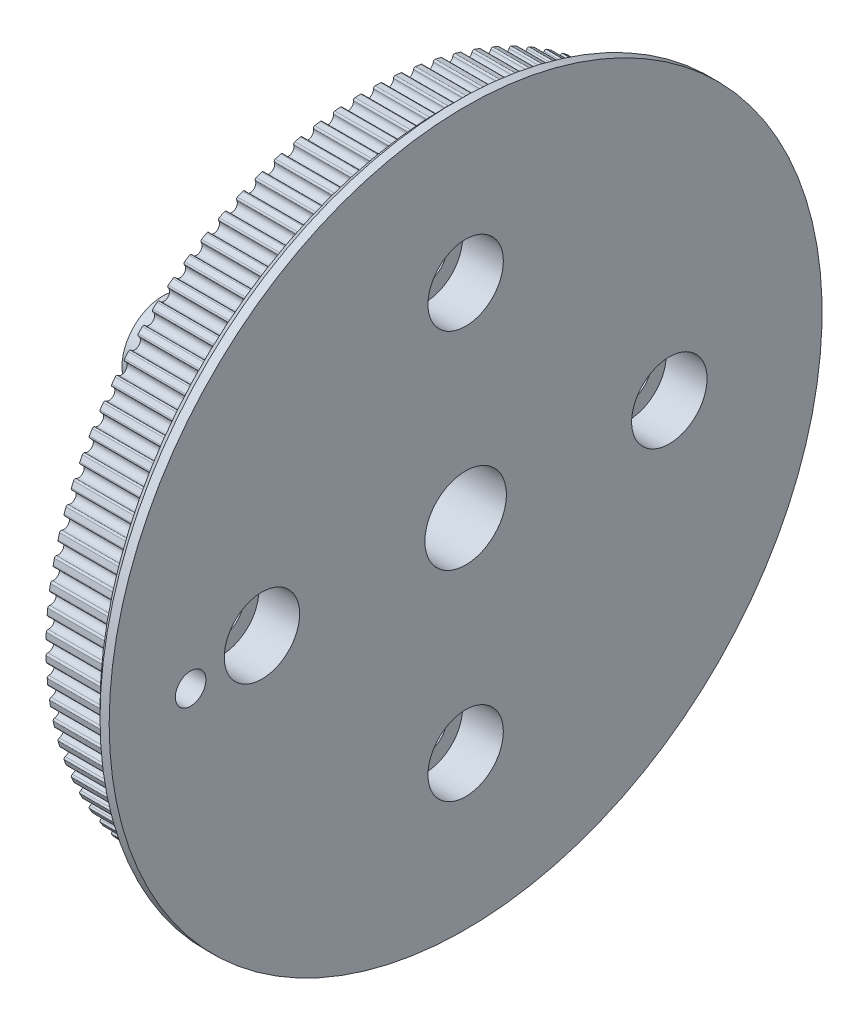
from build123d import *

# Parameters (mm, degrees)
SKETCH1_R           = 31.6
SKETCH1_R_2         = 4
BOSS_EXTRUDE1_DEPTH = 7.7
SKETCH2_R           = 0.55
CUT_EXTRUDE1_DEPTH  = 7.7
FILLET1_R           = 0.16
SKETCH3_R           = 35
SKETCH3_R_2         = 4
BOSS_EXTRUDE2_DEPTH = 1.9
SKETCH6_R           = 2.2
CUT_EXTRUDE6_DEPTH  = 9.6
SKETCH7_R           = 3.7
CUT_EXTRUDE4_DEPTH  = 4
CHAMFER1_SIZE       = 1
SKETCH5_R           = 4
BOSS_EXTRUDE3_DEPTH = 6
SKETCH8_R           = 1.5
CUT_EXTRUDE7_DEPTH  = 9.6


with BuildPart() as part:
    # Sketch1 → Boss-Extrude1 (new body)
    with BuildSketch(Plane(origin=(0, 0, 0), x_dir=(0, 0, -1), z_dir=(1, 0, 0))):
        with Locations(Location((0, 0, 0), (0, 0, 180))):
            Circle(SKETCH1_R)
        with Locations(Location((0, 0, 0), (0, 0, 180))):
            Circle(SKETCH1_R_2, mode=Mode.SUBTRACT)
    extrude(amount=BOSS_EXTRUDE1_DEPTH)

    # Sketch2 → Cut-Extrude1 (cut)
    with BuildSketch(Plane(origin=(0, 0, 0), x_dir=(0, 0, -1), z_dir=(1, 0, 0))):
        with Locations((0, 31.39)):
            Circle(SKETCH2_R)
        with Locations((1.970994408, 31.328059005)):
            Circle(SKETCH2_R)
        with Locations((3.934210202, 31.142480474)):
            Circle(SKETCH2_R)
        with Locations((5.881899465, 30.8339968)):
            Circle(SKETCH2_R)
        with Locations((7.806375558, 30.403825428)):
            Circle(SKETCH2_R)
        with Locations((9.700043453, 29.853664047)):
            Circle(SKETCH2_R)
        with Locations((11.555429709, 29.185683892)):
            Circle(SKETCH2_R)
        with Locations((13.365211962, 28.402521177)):
            Circle(SKETCH2_R)
        with Locations((15.12224783, 27.507266687)):
            Circle(SKETCH2_R)
        with Locations((16.819603094, 26.503453582)):
            Circle(SKETCH2_R)
        with Locations((18.450579069, 25.395043453)):
            Circle(SKETCH2_R)
        with Locations((20.008739038, 24.186410691)):
            Circle(SKETCH2_R)
        with Locations((21.487933655, 22.882325215)):
            Circle(SKETCH2_R)
        with Locations((22.882325215, 21.487933655)):
            Circle(SKETCH2_R)
        with Locations((24.186410691, 20.008739038)):
            Circle(SKETCH2_R)
        with Locations((25.395043453, 18.450579069)):
            Circle(SKETCH2_R)
        with Locations((26.503453582, 16.819603094)):
            Circle(SKETCH2_R)
        with Locations((27.507266687, 15.12224783)):
            Circle(SKETCH2_R)
        with Locations((28.402521177, 13.365211962)):
            Circle(SKETCH2_R)
        with Locations((29.185683892, 11.555429709)):
            Circle(SKETCH2_R)
        with Locations((29.853664047, 9.700043453)):
            Circle(SKETCH2_R)
        with Locations((30.403825428, 7.806375558)):
            Circle(SKETCH2_R)
        with Locations((30.8339968, 5.881899465)):
            Circle(SKETCH2_R)
        with Locations((31.142480474, 3.934210202)):
            Circle(SKETCH2_R)
        with Locations((31.328059005, 1.970994408)):
            Circle(SKETCH2_R)
        with Locations((31.39, 0)):
            Circle(SKETCH2_R)
        with Locations((31.328059005, -1.970994408)):
            Circle(SKETCH2_R)
        with Locations((31.142480474, -3.934210202)):
            Circle(SKETCH2_R)
        with Locations((30.8339968, -5.881899465)):
            Circle(SKETCH2_R)
        with Locations((30.403825428, -7.806375558)):
            Circle(SKETCH2_R)
        with Locations((29.853664047, -9.700043453)):
            Circle(SKETCH2_R)
        with Locations((29.185683892, -11.555429709)):
            Circle(SKETCH2_R)
        with Locations((28.402521177, -13.365211962)):
            Circle(SKETCH2_R)
        with Locations((27.507266687, -15.12224783)):
            Circle(SKETCH2_R)
        with Locations((26.503453582, -16.819603094)):
            Circle(SKETCH2_R)
        with Locations((25.395043453, -18.450579069)):
            Circle(SKETCH2_R)
        with Locations((24.186410691, -20.008739038)):
            Circle(SKETCH2_R)
        with Locations((22.882325215, -21.487933655)):
            Circle(SKETCH2_R)
        with Locations((21.487933655, -22.882325215)):
            Circle(SKETCH2_R)
        with Locations((20.008739038, -24.186410691)):
            Circle(SKETCH2_R)
        with Locations((18.450579069, -25.395043453)):
            Circle(SKETCH2_R)
        with Locations((16.819603094, -26.503453582)):
            Circle(SKETCH2_R)
        with Locations((15.12224783, -27.507266687)):
            Circle(SKETCH2_R)
        with Locations((13.365211962, -28.402521177)):
            Circle(SKETCH2_R)
        with Locations((11.555429709, -29.185683892)):
            Circle(SKETCH2_R)
        with Locations((9.700043453, -29.853664047)):
            Circle(SKETCH2_R)
        with Locations((7.806375558, -30.403825428)):
            Circle(SKETCH2_R)
        with Locations((5.881899465, -30.8339968)):
            Circle(SKETCH2_R)
        with Locations((3.934210202, -31.142480474)):
            Circle(SKETCH2_R)
        with Locations((1.970994408, -31.328059005)):
            Circle(SKETCH2_R)
        with Locations((0, -31.39)):
            Circle(SKETCH2_R)
        with Locations((-1.970994408, -31.328059005)):
            Circle(SKETCH2_R)
        with Locations((-3.934210202, -31.142480474)):
            Circle(SKETCH2_R)
        with Locations((-5.881899465, -30.8339968)):
            Circle(SKETCH2_R)
        with Locations((-7.806375558, -30.403825428)):
            Circle(SKETCH2_R)
        with Locations((-9.700043453, -29.853664047)):
            Circle(SKETCH2_R)
        with Locations((-11.555429709, -29.185683892)):
            Circle(SKETCH2_R)
        with Locations((-13.365211962, -28.402521177)):
            Circle(SKETCH2_R)
        with Locations((-15.12224783, -27.507266687)):
            Circle(SKETCH2_R)
        with Locations((-16.819603094, -26.503453582)):
            Circle(SKETCH2_R)
        with Locations((-18.450579069, -25.395043453)):
            Circle(SKETCH2_R)
        with Locations((-20.008739038, -24.186410691)):
            Circle(SKETCH2_R)
        with Locations((-21.487933655, -22.882325215)):
            Circle(SKETCH2_R)
        with Locations((-22.882325215, -21.487933655)):
            Circle(SKETCH2_R)
        with Locations((-24.186410691, -20.008739038)):
            Circle(SKETCH2_R)
        with Locations((-25.395043453, -18.450579069)):
            Circle(SKETCH2_R)
        with Locations((-26.503453582, -16.819603094)):
            Circle(SKETCH2_R)
        with Locations((-27.507266687, -15.12224783)):
            Circle(SKETCH2_R)
        with Locations((-28.402521177, -13.365211962)):
            Circle(SKETCH2_R)
        with Locations((-29.185683892, -11.555429709)):
            Circle(SKETCH2_R)
        with Locations((-29.853664047, -9.700043453)):
            Circle(SKETCH2_R)
        with Locations((-30.403825428, -7.806375558)):
            Circle(SKETCH2_R)
        with Locations((-30.8339968, -5.881899465)):
            Circle(SKETCH2_R)
        with Locations((-31.142480474, -3.934210202)):
            Circle(SKETCH2_R)
        with Locations((-31.328059005, -1.970994408)):
            Circle(SKETCH2_R)
        with Locations((-31.39, 0)):
            Circle(SKETCH2_R)
        with Locations((-31.328059005, 1.970994408)):
            Circle(SKETCH2_R)
        with Locations((-31.142480474, 3.934210202)):
            Circle(SKETCH2_R)
        with Locations((-30.8339968, 5.881899465)):
            Circle(SKETCH2_R)
        with Locations((-30.403825428, 7.806375558)):
            Circle(SKETCH2_R)
        with Locations((-29.853664047, 9.700043453)):
            Circle(SKETCH2_R)
        with Locations((-29.185683892, 11.555429709)):
            Circle(SKETCH2_R)
        with Locations((-28.402521177, 13.365211962)):
            Circle(SKETCH2_R)
        with Locations((-27.507266687, 15.12224783)):
            Circle(SKETCH2_R)
        with Locations((-26.503453582, 16.819603094)):
            Circle(SKETCH2_R)
        with Locations((-25.395043453, 18.450579069)):
            Circle(SKETCH2_R)
        with Locations((-24.186410691, 20.008739038)):
            Circle(SKETCH2_R)
        with Locations((-22.882325215, 21.487933655)):
            Circle(SKETCH2_R)
        with Locations((-21.487933655, 22.882325215)):
            Circle(SKETCH2_R)
        with Locations((-20.008739038, 24.186410691)):
            Circle(SKETCH2_R)
        with Locations((-18.450579069, 25.395043453)):
            Circle(SKETCH2_R)
        with Locations((-16.819603094, 26.503453582)):
            Circle(SKETCH2_R)
        with Locations((-15.12224783, 27.507266687)):
            Circle(SKETCH2_R)
        with Locations((-13.365211962, 28.402521177)):
            Circle(SKETCH2_R)
        with Locations((-11.555429709, 29.185683892)):
            Circle(SKETCH2_R)
        with Locations((-9.700043453, 29.853664047)):
            Circle(SKETCH2_R)
        with Locations((-7.806375558, 30.403825428)):
            Circle(SKETCH2_R)
        with Locations((-5.881899465, 30.8339968)):
            Circle(SKETCH2_R)
        with Locations((-3.934210202, 31.142480474)):
            Circle(SKETCH2_R)
        with Locations((-1.970994408, 31.328059005)):
            Circle(SKETCH2_R)
    extrude(amount=CUT_EXTRUDE1_DEPTH, mode=Mode.SUBTRACT)

    # Fillet1
    fillet1_edges = [part.edges().sort_by_distance(p)[0] for p in [
        (3.85, 31.59588404, 0.510011532),
        (3.85, 31.59588404, -0.510011532),
        (3.85, 31.501512891, 2.492927114),
        (3.85, 31.565560669, 1.474916834),
        (3.85, 31.282819662, 4.466004252),
        (3.85, 31.410662451, 3.454024376),
        (3.85, 30.940667436, 6.421456112),
        (3.85, 31.131800699, 5.419500462),
        (3.85, 30.476406531, 8.351565418),
        (3.85, 30.730075952, 7.363588255),
        (3.85, 29.891869173, 10.248714911),
        (3.85, 30.207073634, 9.27861533),
        (3.85, 29.189362264, 12.105417408),
        (3.85, 29.564857798, 11.157023949),
        (3.85, 28.371658277, 13.914345353),
        (3.85, 28.805962974, 12.991400892),
        (3.85, 27.441984317, 15.668359734),
        (3.85, 27.933384175, 14.774506711),
        (3.85, 26.404009381, 17.360538258),
        (3.85, 26.95056507, 16.499304301),
        (3.85, 25.261829884, 18.984202668),
        (3.85, 25.861384397, 18.158986675),
        (3.85, 24.019953484, 20.532945103),
        (3.85, 24.670140655, 19.747003825),
        (3.85, 22.683281303, 22.000653385),
        (3.85, 23.381535138, 21.257088572),
        (3.85, 21.257088572, 23.381535138),
        (3.85, 22.000653385, 22.683281303),
        (3.85, 19.747003825, 24.670140655),
        (3.85, 20.532945103, 24.019953484),
        (3.85, 18.158986675, 25.861384397),
        (3.85, 18.984202668, 25.261829884),
        (3.85, 16.499304301, 26.95056507),
        (3.85, 17.360538258, 26.404009381),
        (3.85, 14.774506711, 27.933384175),
        (3.85, 15.668359734, 27.441984317),
        (3.85, 12.991400892, 28.805962974),
        (3.85, 13.914345353, 28.371658277),
        (3.85, 11.157023949, 29.564857798),
        (3.85, 12.105417408, 29.189362264),
        (3.85, 9.27861533, 30.207073634),
        (3.85, 10.248714911, 29.891869173),
        (3.85, 7.363588255, 30.730075952),
        (3.85, 8.351565418, 30.476406531),
        (3.85, 5.419500462, 31.131800699),
        (3.85, 6.421456112, 30.940667436),
        (3.85, 3.454024376, 31.410662451),
        (3.85, 4.466004252, 31.282819662),
        (3.85, 1.474916834, 31.565560669),
        (3.85, 2.492927114, 31.501512891),
        (3.85, -0.510011532, 31.59588404),
        (3.85, 0.510011532, 31.59588404),
        (3.85, -2.492927114, 31.501512891),
        (3.85, -1.474916834, 31.565560669),
        (3.85, -4.466004252, 31.282819662),
        (3.85, -3.454024376, 31.410662451),
        (3.85, -6.421456112, 30.940667436),
        (3.85, -5.419500462, 31.131800699),
        (3.85, -8.351565418, 30.476406531),
        (3.85, -7.363588255, 30.730075952),
        (3.85, -10.248714911, 29.891869173),
        (3.85, -9.27861533, 30.207073634),
        (3.85, -12.105417408, 29.189362264),
        (3.85, -11.157023949, 29.564857798),
        (3.85, -13.914345353, 28.371658277),
        (3.85, -12.991400892, 28.805962974),
        (3.85, -15.668359734, 27.441984317),
        (3.85, -14.774506711, 27.933384175),
        (3.85, -17.360538258, 26.404009381),
        (3.85, -16.499304301, 26.95056507),
        (3.85, -18.984202668, 25.261829884),
        (3.85, -18.158986675, 25.861384397),
        (3.85, -20.532945103, 24.019953484),
        (3.85, -19.747003825, 24.670140655),
        (3.85, -22.000653385, 22.683281303),
        (3.85, -21.257088572, 23.381535138),
        (3.85, -23.381535138, 21.257088572),
        (3.85, -22.683281303, 22.000653385),
        (3.85, -24.670140655, 19.747003825),
        (3.85, -24.019953484, 20.532945103),
        (3.85, -25.861384397, 18.158986675),
        (3.85, -25.261829884, 18.984202668),
        (3.85, -26.95056507, 16.499304301),
        (3.85, -26.404009381, 17.360538258),
        (3.85, -27.933384175, 14.774506711),
        (3.85, -27.441984317, 15.668359734),
        (3.85, -28.805962974, 12.991400892),
        (3.85, -28.371658277, 13.914345353),
        (3.85, -29.564857798, 11.157023949),
        (3.85, -29.189362264, 12.105417408),
        (3.85, -30.207073634, 9.27861533),
        (3.85, -29.891869173, 10.248714911),
        (3.85, -30.730075952, 7.363588255),
        (3.85, -30.476406531, 8.351565418),
        (3.85, -31.131800699, 5.419500462),
        (3.85, -30.940667436, 6.421456112),
        (3.85, -31.410662451, 3.454024376),
        (3.85, -31.282819662, 4.466004252),
        (3.85, -31.565560669, 1.474916834),
        (3.85, -31.501512891, 2.492927114),
        (3.85, -31.59588404, -0.510011532),
        (3.85, -31.59588404, 0.510011532),
        (3.85, -31.501512891, -2.492927114),
        (3.85, -31.565560669, -1.474916834),
        (3.85, -31.282819662, -4.466004252),
        (3.85, -31.410662451, -3.454024376),
        (3.85, -30.940667436, -6.421456112),
        (3.85, -31.131800699, -5.419500462),
        (3.85, -30.476406531, -8.351565418),
        (3.85, -30.730075952, -7.363588255),
        (3.85, -29.891869173, -10.248714911),
        (3.85, -30.207073634, -9.27861533),
        (3.85, -29.189362264, -12.105417408),
        (3.85, -29.564857798, -11.157023949),
        (3.85, -28.371658277, -13.914345353),
        (3.85, -28.805962974, -12.991400892),
        (3.85, -27.441984317, -15.668359734),
        (3.85, -27.933384175, -14.774506711),
        (3.85, -26.404009381, -17.360538258),
        (3.85, -26.95056507, -16.499304301),
        (3.85, -25.261829884, -18.984202668),
        (3.85, -25.861384397, -18.158986675),
        (3.85, -24.019953484, -20.532945103),
        (3.85, -24.670140655, -19.747003825),
        (3.85, -22.683281303, -22.000653385),
        (3.85, -23.381535138, -21.257088572),
        (3.85, -21.257088572, -23.381535138),
        (3.85, -22.000653385, -22.683281303),
        (3.85, -19.747003825, -24.670140655),
        (3.85, -20.532945103, -24.019953484),
        (3.85, -18.158986675, -25.861384397),
        (3.85, -18.984202668, -25.261829884),
        (3.85, -16.499304301, -26.95056507),
        (3.85, -17.360538258, -26.404009381),
        (3.85, -14.774506711, -27.933384175),
        (3.85, -15.668359734, -27.441984317),
        (3.85, -12.991400892, -28.805962974),
        (3.85, -13.914345353, -28.371658277),
        (3.85, -11.157023949, -29.564857798),
        (3.85, -12.105417408, -29.189362264),
        (3.85, -9.27861533, -30.207073634),
        (3.85, -10.248714911, -29.891869173),
        (3.85, -7.363588255, -30.730075952),
        (3.85, -8.351565418, -30.476406531),
        (3.85, -5.419500462, -31.131800699),
        (3.85, -6.421456112, -30.940667436),
        (3.85, -3.454024376, -31.410662451),
        (3.85, -4.466004252, -31.282819662),
        (3.85, -1.474916834, -31.565560669),
        (3.85, -2.492927114, -31.501512891),
        (3.85, 0.510011532, -31.59588404),
        (3.85, -0.510011532, -31.59588404),
        (3.85, 2.492927114, -31.501512891),
        (3.85, 1.474916834, -31.565560669),
        (3.85, 4.466004252, -31.282819662),
        (3.85, 3.454024376, -31.410662451),
        (3.85, 6.421456112, -30.940667436),
        (3.85, 5.419500462, -31.131800699),
        (3.85, 8.351565418, -30.476406531),
        (3.85, 7.363588255, -30.730075952),
        (3.85, 10.248714911, -29.891869173),
        (3.85, 9.27861533, -30.207073634),
        (3.85, 12.105417408, -29.189362264),
        (3.85, 11.157023949, -29.564857798),
        (3.85, 13.914345353, -28.371658277),
        (3.85, 12.991400892, -28.805962974),
        (3.85, 15.668359734, -27.441984317),
        (3.85, 14.774506711, -27.933384175),
        (3.85, 17.360538258, -26.404009381),
        (3.85, 16.499304301, -26.95056507),
        (3.85, 18.984202668, -25.261829884),
        (3.85, 18.158986675, -25.861384397),
        (3.85, 20.532945103, -24.019953484),
        (3.85, 19.747003825, -24.670140655),
        (3.85, 22.000653385, -22.683281303),
        (3.85, 21.257088572, -23.381535138),
        (3.85, 23.381535138, -21.257088572),
        (3.85, 22.683281303, -22.000653385),
        (3.85, 24.670140655, -19.747003825),
        (3.85, 24.019953484, -20.532945103),
        (3.85, 25.861384397, -18.158986675),
        (3.85, 25.261829884, -18.984202668),
        (3.85, 26.95056507, -16.499304301),
        (3.85, 26.404009381, -17.360538258),
        (3.85, 27.933384175, -14.774506711),
        (3.85, 27.441984317, -15.668359734),
        (3.85, 28.805962974, -12.991400892),
        (3.85, 28.371658277, -13.914345353),
        (3.85, 29.564857798, -11.157023949),
        (3.85, 29.189362264, -12.105417408),
        (3.85, 30.207073634, -9.27861533),
        (3.85, 29.891869173, -10.248714911),
        (3.85, 30.730075952, -7.363588255),
        (3.85, 30.476406531, -8.351565418),
        (3.85, 31.131800699, -5.419500462),
        (3.85, 30.940667436, -6.421456112),
        (3.85, 31.410662451, -3.454024376),
        (3.85, 31.282819662, -4.466004252),
        (3.85, 31.565560669, -1.474916834),
        (3.85, 31.501512891, -2.492927114),
    ]]
    fillet(fillet1_edges, radius=FILLET1_R)

    # Sketch3 → Boss-Extrude2 (add)
    with BuildSketch(Plane(origin=(7.7, 0, 0), x_dir=(0, 0, -1), z_dir=(1, 0, 0))):
        with Locations(Location((0, 0, 0), (0, 0, 180))):
            Circle(SKETCH3_R)
        with Locations(Location((0, 0, 0), (0, 0, 180))):
            Circle(SKETCH3_R_2, mode=Mode.SUBTRACT)
    extrude(amount=BOSS_EXTRUDE2_DEPTH)

    # Sketch6 → Cut-Extrude6 (cut)
    with BuildSketch(Plane(origin=(9.6, 0, 0), x_dir=(0, 0, -1), z_dir=(1, 0, 0))):
        with Locations((0, -20)):
            Circle(SKETCH6_R)
        with Locations((-20, 0)):
            Circle(SKETCH6_R)
        with Locations((0, 20)):
            Circle(SKETCH6_R)
        with Locations((20, 0)):
            Circle(SKETCH6_R)
    extrude(amount=-CUT_EXTRUDE6_DEPTH, mode=Mode.SUBTRACT)

    # Sketch7 → Cut-Extrude4 (cut)
    with BuildSketch(Plane(origin=(9.6, 0, 0), x_dir=(0, 0, -1), z_dir=(1, 0, 0))):
        with Locations((0, -20)):
            Circle(SKETCH7_R)
        with Locations((-20, 0)):
            Circle(SKETCH7_R)
        with Locations((0, 20)):
            Circle(SKETCH7_R)
        with Locations((20, 0)):
            Circle(SKETCH7_R)
    extrude(amount=-CUT_EXTRUDE4_DEPTH, mode=Mode.SUBTRACT)

    # Chamfer1
    chamfer1_edges = [part.edges().sort_by_distance(p)[0] for p in [
        (7.7, 0, -35),
    ]]
    chamfer(chamfer1_edges, length=CHAMFER1_SIZE)

    # Sketch5 → Boss-Extrude3 (add)
    with BuildSketch(Plane.ZY):
        with Locations(Location((-14.142135624, -14.142135624, 0), (0, 0, 180))):
            Circle(SKETCH5_R)
        with Locations(Location((-14.142135624, 14.142135624, 0), (0, 0, 180))):
            Circle(SKETCH5_R)
        with Locations(Location((14.142135624, 14.142135624, 0), (0, 0, 180))):
            Circle(SKETCH5_R)
        with Locations(Location((14.142135624, -14.142135624, 0), (0, 0, 180))):
            Circle(SKETCH5_R)
    extrude(amount=BOSS_EXTRUDE3_DEPTH)

    # Sketch8 → Cut-Extrude7 (cut)
    with BuildSketch(Plane(origin=(9.6, 0, 0), x_dir=(0, 0, -1), z_dir=(1, 0, 0))):
        with Locations((-27, -1)):
            Circle(SKETCH8_R)
    extrude(amount=-CUT_EXTRUDE7_DEPTH, mode=Mode.SUBTRACT)


solid = part.part
